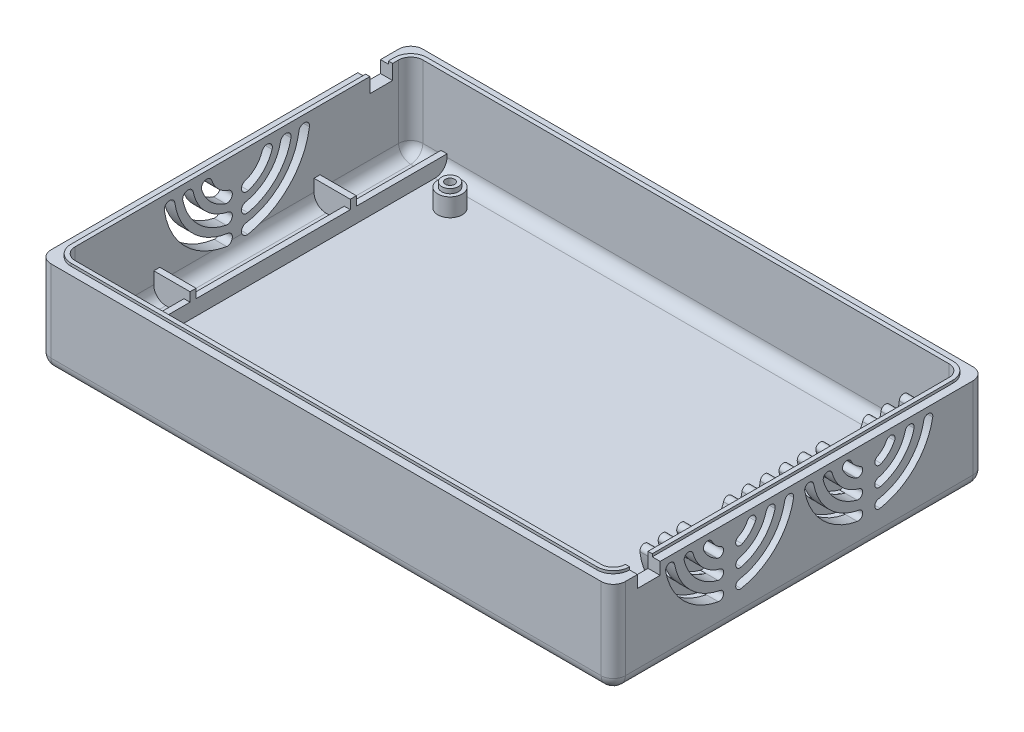
from build123d import *
from build123d.topology import SkipClean

# Parameters (mm, degrees)
SKETCH1_W            = 190
SKETCH1_H            = 123
SKETCH1_R            = 1.5
BOSS_EXTRUDE1_DEPTH  = 4
SKETCH3_R            = 4
SKETCH3_R_2          = 1.5
BOSS_EXTRUDE3_DEPTH  = 6
SKETCH4_R            = 2.75
SKETCH4_R_2          = 1.5
BOSS_EXTRUDE4_DEPTH  = 1.5
SKETCH2_W            = 190
SKETCH2_H            = 123
SKETCH2_W_2          = 182
SKETCH2_H_2          = 115
BOSS_EXTRUDE2_DEPTH  = 27
FILLET1_R            = 4
FILLET2_R            = 4
SKETCH6_R            = 6
SKETCH6_R_2          = 3
BOSS_EXTRUDE5_DEPTH  = 4
FILLET3_R            = 2
SKETCH7_W            = 2
SKETCH7_H            = 115
BOSS_EXTRUDE6_DEPTH  = 5
SKETCH8_W            = 4
SKETCH8_H            = 7.5
CUT_EXTRUDE1_DEPTH   = 4
CUT_EXTRUDE2_DEPTH   = 10
CUT_EXTRUDE4_DEPTH   = 10
BOSS_EXTRUDE8_DEPTH  = 1.8
BOSS_EXTRUDE9_DEPTH  = 2.5
SKETCH13_W           = 12
SKETCH13_H           = 2
BOSS_EXTRUDE10_DEPTH = 8
BOSS_EXTRUDE11_START = 0.9
BOSS_EXTRUDE11_DEPTH = 0.9


with BuildPart() as part:
    # Sketch1 → Boss-Extrude1 (new body)
    with BuildSketch(Plane(origin=(0, 0, 0), x_dir=(1, 0, 0), z_dir=(0, 1, 0))):
        with Locations((-5.5, 0)):
            Rectangle(SKETCH1_W, SKETCH1_H)
        with Locations(Location((73.5, -47.5, 0), (0, 0, 270))):
            Circle(SKETCH1_R, mode=Mode.SUBTRACT)
        with Locations(Location((73.5, 47.5, 0), (0, 0, 270))):
            Circle(SKETCH1_R, mode=Mode.SUBTRACT)
        with Locations(Location((-73.5, 47.5, 0), (0, 0, 270))):
            Circle(SKETCH1_R, mode=Mode.SUBTRACT)
        with Locations(Location((-73.5, -47.5, 0), (0, 0, 270))):
            Circle(SKETCH1_R, mode=Mode.SUBTRACT)
    extrude(amount=BOSS_EXTRUDE1_DEPTH)

    # Sketch3 → Boss-Extrude3 (add)
    # profile 1 of 4: a face of its own
    with BuildSketch(Plane(origin=(0, 4, 0), x_dir=(1, 0, 0), z_dir=(0, 1, 0))):
        with Locations(Location((-73.5, 47.5, 0), (0, 0, 270))):
            Circle(SKETCH3_R)
        with Locations(Location((-73.5, 47.5, 0), (0, 0, 270))):
            Circle(SKETCH3_R_2, mode=Mode.SUBTRACT)
    # profile 2 of 4: a face of its own
    with BuildSketch(Plane(origin=(0, 4, 0), x_dir=(1, 0, 0), z_dir=(0, 1, 0))):
        with Locations(Location((-73.5, -47.5, 0), (0, 0, 270))):
            Circle(SKETCH3_R)
        with Locations(Location((-73.5, -47.5, 0), (0, 0, 270))):
            Circle(SKETCH3_R_2, mode=Mode.SUBTRACT)
    # profile 3 of 4: a face of its own
    with BuildSketch(Plane(origin=(0, 4, 0), x_dir=(1, 0, 0), z_dir=(0, 1, 0))):
        with Locations(Location((73.5, -47.5, 0), (0, 0, 270))):
            Circle(SKETCH3_R)
        with Locations(Location((73.5, -47.5, 0), (0, 0, 270))):
            Circle(SKETCH3_R_2, mode=Mode.SUBTRACT)
    # profile 4 of 4: a face of its own
    with BuildSketch(Plane(origin=(0, 4, 0), x_dir=(1, 0, 0), z_dir=(0, 1, 0))):
        with Locations(Location((73.5, 47.5, 0), (0, 0, 270))):
            Circle(SKETCH3_R)
        with Locations(Location((73.5, 47.5, 0), (0, 0, 270))):
            Circle(SKETCH3_R_2, mode=Mode.SUBTRACT)
    extrude(amount=BOSS_EXTRUDE3_DEPTH)

    # Sketch4 → Boss-Extrude4 (add)
    # profile 1 of 4: a face of its own
    with BuildSketch(Plane(origin=(0, 10, 0), x_dir=(1, 0, 0), z_dir=(0, 1, 0))):
        with Locations(Location((-73.5, 47.5, 0), (0, 0, 270))):
            Circle(SKETCH4_R)
        with Locations(Location((-73.5, 47.5, 0), (0, 0, 270))):
            Circle(SKETCH4_R_2, mode=Mode.SUBTRACT)
    # profile 2 of 4: a face of its own
    with BuildSketch(Plane(origin=(0, 10, 0), x_dir=(1, 0, 0), z_dir=(0, 1, 0))):
        with Locations(Location((73.5, 47.5, 0), (0, 0, 270))):
            Circle(SKETCH4_R)
        with Locations(Location((73.5, 47.5, 0), (0, 0, 270))):
            Circle(SKETCH4_R_2, mode=Mode.SUBTRACT)
    # profile 3 of 4: a face of its own
    with BuildSketch(Plane(origin=(0, 10, 0), x_dir=(1, 0, 0), z_dir=(0, 1, 0))):
        with Locations(Location((73.5, -47.5, 0), (0, 0, 270))):
            Circle(SKETCH4_R)
        with Locations(Location((73.5, -47.5, 0), (0, 0, 270))):
            Circle(SKETCH4_R_2, mode=Mode.SUBTRACT)
    # profile 4 of 4: a face of its own
    with BuildSketch(Plane(origin=(0, 10, 0), x_dir=(1, 0, 0), z_dir=(0, 1, 0))):
        with Locations(Location((-73.5, -47.5, 0), (0, 0, 270))):
            Circle(SKETCH4_R)
        with Locations(Location((-73.5, -47.5, 0), (0, 0, 270))):
            Circle(SKETCH4_R_2, mode=Mode.SUBTRACT)
    extrude(amount=BOSS_EXTRUDE4_DEPTH)

    # Sketch2 → Boss-Extrude2 (add)
    with BuildSketch(Plane(origin=(0, 4, 0), x_dir=(1, 0, 0), z_dir=(0, 1, 0))):
        with Locations((-5.5, 0)):
            Rectangle(SKETCH2_W, SKETCH2_H)
        with Locations((-5.5, 0)):
            Rectangle(SKETCH2_W_2, SKETCH2_H_2, mode=Mode.SUBTRACT)
    extrude(amount=BOSS_EXTRUDE2_DEPTH)

    # Fillet1
    fillet1_edges = [part.edges().sort_by_distance(p)[0] for p in [
        (-5.5, 4, -57.5),
        (-96.5, 4, 0),
        (-5.5, 4, 57.5),
        (85.5, 4, 0),
        (-96.5, 17.5, -57.5),
        (-96.5, 17.5, 57.5),
        (85.5, 17.5, 57.5),
        (85.5, 17.5, -57.5),
    ]]
    fillet(fillet1_edges, radius=FILLET1_R)

    # Fillet2
    fillet2_edges = [part.edges().sort_by_distance(p)[0] for p in [
        (-5.5, 0, -61.5),
        (89.5, 0, 0),
        (-5.5, 0, 61.5),
        (-100.5, 0, 0),
        (-100.5, 15.5, -61.5),
        (89.5, 15.5, -61.5),
        (89.5, 15.5, 61.5),
        (-100.5, 15.5, 61.5),
    ]]
    fillet(fillet2_edges, radius=FILLET2_R)

    # Sketch6 → Boss-Extrude5 (add)
    # profile 1 of 4: a face of its own
    with BuildSketch(Plane.XZ):
        with Locations(Location((-73.5, 47.5, 0), (0, 0, 90))):
            Circle(SKETCH6_R)
        with Locations(Location((-73.5, 47.5, 0), (0, 0, 270))):
            Circle(SKETCH6_R_2, mode=Mode.SUBTRACT)
    # profile 2 of 4: a face of its own
    with BuildSketch(Plane.XZ):
        with Locations(Location((-73.5, -47.5, 0), (0, 0, 90))):
            Circle(SKETCH6_R)
        with Locations(Location((-73.5, -47.5, 0), (0, 0, 270))):
            Circle(SKETCH6_R_2, mode=Mode.SUBTRACT)
    # profile 3 of 4: a face of its own
    with BuildSketch(Plane.XZ):
        with Locations(Location((73.5, -47.5, 0), (0, 0, 90))):
            Circle(SKETCH6_R)
        with Locations(Location((73.5, -47.5, 0), (0, 0, 270))):
            Circle(SKETCH6_R_2, mode=Mode.SUBTRACT)
    # profile 4 of 4: a face of its own
    with BuildSketch(Plane.XZ):
        with Locations(Location((73.5, 47.5, 0), (0, 0, 90))):
            Circle(SKETCH6_R)
        with Locations(Location((73.5, 47.5, 0), (0, 0, 270))):
            Circle(SKETCH6_R_2, mode=Mode.SUBTRACT)
    extrude(amount=BOSS_EXTRUDE5_DEPTH)

    # Fillet3
    fillet3_edges = [part.edges().sort_by_distance(p)[0] for p in [
        (-73.5, 0, 41.5),
        (-73.5, -4, 41.5),
        (-73.5, 0, -53.5),
        (-73.5, -4, -53.5),
        (73.5, 0, -53.5),
        (73.5, -4, -53.5),
        (73.5, 0, 41.5),
        (73.5, -4, 41.5),
    ]]
    fillet(fillet3_edges, radius=FILLET3_R - 0.0001)  # a hair under: the kernel refuses the full size

    # Sketch7 → Boss-Extrude6 (add)
    with BuildSketch(Plane(origin=(0, 4, 0), x_dir=(1, 0, 0), z_dir=(0, 1, 0))):
        with Locations((-85.5, 0)):
            Rectangle(SKETCH7_W, SKETCH7_H)
    extrude(amount=BOSS_EXTRUDE6_DEPTH)

    # Sketch8 → Cut-Extrude1 (cut)
    with BuildSketch(Plane(origin=(0, 31, 0), x_dir=(1, 0, 0), z_dir=(0, 1, 0))):
        with Locations((-98.5, 47.75)):
            Rectangle(SKETCH8_W, SKETCH8_H)
        with Locations((87.5, -49.75)):
            Rectangle(SKETCH8_W, SKETCH8_H)
    extrude(amount=-CUT_EXTRUDE1_DEPTH, mode=Mode.SUBTRACT)

    # Sketch9 → Cut-Extrude2 (cut)
    with BuildSketch(Plane.ZY.offset(100.5)):
        with BuildLine():
            ThreePointArc((-11.648423236, 27.208333333), (-8.66205807, 22.33794193), (-3.791666667, 19.351576764))
            ThreePointArc((-3.791666667, 19.351576764), (-1.585939538, 20.473970559), (-2.708333333, 22.679697688))
            ThreePointArc((-2.708333333, 22.679697688), (-6.187184335, 24.812815665), (-8.320302312, 28.291666667))
            ThreePointArc((-8.320302312, 28.291666667), (-10.526029441, 29.414060462), (-11.648423236, 27.208333333))
        make_face()
        with BuildLine():
            ThreePointArc((-17.892474778, 27.40530303), (-12.904698757, 18.095301243), (-3.59469697, 13.107525222))
            ThreePointArc((-3.59469697, 13.107525222), (-1.53428324, 14.478545011), (-2.90530303, 16.538958741))
            ThreePointArc((-2.90530303, 16.538958741), (-10.429825023, 20.570174977), (-14.461041259, 28.09469697))
            ThreePointArc((-14.461041259, 28.09469697), (-16.521454989, 29.46571676), (-17.892474778, 27.40530303))
        make_face()
        with BuildLine():
            ThreePointArc((-23.995688109, 27.497222222), (-17.147339444, 13.852660556), (-3.502777778, 7.004311891))
            ThreePointArc((-3.502777778, 7.004311891), (-1.518352404, 8.483181708), (-2.997222222, 10.467607082))
            ThreePointArc((-2.997222222, 10.467607082), (-14.67246571, 16.32753429), (-20.532392918, 28.002777778))
            ThreePointArc((-20.532392918, 28.002777778), (-22.516818292, 29.481647596), (-23.995688109, 27.497222222))
        make_face()
        with BuildLine():
            ThreePointArc((3.502777778, 7.004311891), (17.147339444, 13.852660556), (23.995688109, 27.497222222))
            ThreePointArc((23.995688109, 27.497222222), (22.516818292, 29.481647596), (20.532392918, 28.002777778))
            ThreePointArc((20.532392918, 28.002777778), (14.67246571, 16.32753429), (2.997222222, 10.467607082))
            ThreePointArc((2.997222222, 10.467607082), (1.518352404, 8.483181708), (3.502777778, 7.004311891))
        make_face()
        with BuildLine():
            ThreePointArc((3.791666667, 19.351576764), (8.66205807, 22.33794193), (11.648423236, 27.208333333))
            ThreePointArc((11.648423236, 27.208333333), (10.526029441, 29.414060462), (8.320302312, 28.291666667))
            ThreePointArc((8.320302312, 28.291666667), (6.187184335, 24.812815665), (2.708333333, 22.679697688))
            ThreePointArc((2.708333333, 22.679697688), (1.585939538, 20.473970559), (3.791666667, 19.351576764))
        make_face()
        with BuildLine():
            ThreePointArc((3.59469697, 13.107525222), (12.904698757, 18.095301243), (17.892474778, 27.40530303))
            ThreePointArc((17.892474778, 27.40530303), (16.521454989, 29.46571676), (14.461041259, 28.09469697))
            ThreePointArc((14.461041259, 28.09469697), (10.429825023, 20.570174977), (2.90530303, 16.538958741))
            ThreePointArc((2.90530303, 16.538958741), (1.53428324, 14.478545011), (3.59469697, 13.107525222))
        make_face()
    extrude(amount=-CUT_EXTRUDE2_DEPTH, mode=Mode.SUBTRACT)

    # Sketch10 → Cut-Extrude4 (cut)
    with BuildSketch(Plane(origin=(89.5, 0, 0), x_dir=(0, 0, -1), z_dir=(1, 0, 0))):
        with BuildLine():
            ThreePointArc((1.831778682, 27.2375), (7.797204204, 15.797204204), (19.2375, 9.831778682))
            ThreePointArc((19.2375, 9.831778682), (20.97685265, 11.046131332), (19.7625, 12.785483983))
            ThreePointArc((19.7625, 12.785483983), (9.918524548, 17.918524548), (4.785483983, 27.7625))
            ThreePointArc((4.785483983, 27.7625), (3.046131332, 28.97685265), (1.831778682, 27.2375))
        make_face()
        with BuildLine():
            ThreePointArc((7.992189533, 27.125), (12.039844892, 20.039844892), (19.125, 15.992189533))
            ThreePointArc((19.125, 15.992189533), (20.952368755, 17.069558288), (19.875, 18.896927043))
            ThreePointArc((19.875, 18.896927043), (14.161165235, 22.161165235), (10.896927043, 27.875))
            ThreePointArc((10.896927043, 27.875), (9.069558288, 28.952368755), (7.992189533, 27.125))
        make_face()
        with BuildLine():
            ThreePointArc((14.457425099, 26.84375), (16.282485579, 24.282485579), (18.84375, 22.457425099))
            ThreePointArc((18.84375, 22.457425099), (20.848827616, 23.150002715), (20.15625, 25.155080331))
            ThreePointArc((20.15625, 25.155080331), (18.403805922, 26.403805922), (17.155080331, 28.15625))
            ThreePointArc((17.155080331, 28.15625), (15.150002715, 28.848827616), (14.457425099, 26.84375))
        make_face()
        with BuildLine():
            ThreePointArc((44.168221318, 27.2375), (38.202795796, 15.797204204), (26.7625, 9.831778682))
            ThreePointArc((26.7625, 9.831778682), (25.02314735, 11.046131332), (26.2375, 12.785483983))
            ThreePointArc((26.2375, 12.785483983), (36.081475452, 17.918524548), (41.214516017, 27.7625))
            ThreePointArc((41.214516017, 27.7625), (42.953868668, 28.97685265), (44.168221318, 27.2375))
        make_face()
        with BuildLine():
            ThreePointArc((38.007810467, 27.125), (33.960155108, 20.039844892), (26.875, 15.992189533))
            ThreePointArc((26.875, 15.992189533), (25.047631245, 17.069558288), (26.125, 18.896927043))
            ThreePointArc((26.125, 18.896927043), (31.838834765, 22.161165235), (35.103072957, 27.875))
            ThreePointArc((35.103072957, 27.875), (36.930441712, 28.952368755), (38.007810467, 27.125))
        make_face()
        with BuildLine():
            ThreePointArc((31.542574901, 26.84375), (29.717514421, 24.282485579), (27.15625, 22.457425099))
            ThreePointArc((27.15625, 22.457425099), (25.151172384, 23.150002715), (25.84375, 25.155080331))
            ThreePointArc((25.84375, 25.155080331), (27.596194078, 26.403805922), (28.844919669, 28.15625))
            ThreePointArc((28.844919669, 28.15625), (30.849997285, 28.848827616), (31.542574901, 26.84375))
        make_face()
        with BuildLine():
            ThreePointArc((1.831778682, 34.7625), (7.797204204, 46.202795796), (19.2375, 52.168221318))
            ThreePointArc((19.2375, 52.168221318), (20.97685265, 50.953868668), (19.7625, 49.214516017))
            ThreePointArc((19.7625, 49.214516017), (9.918524548, 44.081475452), (4.785483983, 34.2375))
            ThreePointArc((4.785483983, 34.2375), (3.046131332, 33.02314735), (1.831778682, 34.7625))
        make_face()
        with BuildLine():
            ThreePointArc((7.992189533, 34.875), (12.039844892, 41.960155108), (19.125, 46.007810467))
            ThreePointArc((19.125, 46.007810467), (20.952368755, 44.930441712), (19.875, 43.103072957))
            ThreePointArc((19.875, 43.103072957), (14.161165235, 39.838834765), (10.896927043, 34.125))
            ThreePointArc((10.896927043, 34.125), (9.069558288, 33.047631245), (7.992189533, 34.875))
        make_face()
        with BuildLine():
            ThreePointArc((14.457425099, 35.15625), (16.282485579, 37.717514421), (18.84375, 39.542574901))
            ThreePointArc((18.84375, 39.542574901), (20.848827616, 38.849997285), (20.15625, 36.844919669))
            ThreePointArc((20.15625, 36.844919669), (18.403805922, 35.596194078), (17.155080331, 33.84375))
            ThreePointArc((17.155080331, 33.84375), (15.150002715, 33.151172384), (14.457425099, 35.15625))
        make_face()
        with BuildLine():
            ThreePointArc((44.168221318, 34.7625), (38.202795796, 46.202795796), (26.7625, 52.168221318))
            ThreePointArc((26.7625, 52.168221318), (25.02314735, 50.953868668), (26.2375, 49.214516017))
            ThreePointArc((26.2375, 49.214516017), (36.081475452, 44.081475452), (41.214516017, 34.2375))
            ThreePointArc((41.214516017, 34.2375), (42.953868668, 33.02314735), (44.168221318, 34.7625))
        make_face()
        with BuildLine():
            ThreePointArc((38.007810467, 34.875), (33.960155108, 41.960155108), (26.875, 46.007810467))
            ThreePointArc((26.875, 46.007810467), (25.047631245, 44.930441712), (26.125, 43.103072957))
            ThreePointArc((26.125, 43.103072957), (31.838834765, 39.838834765), (35.103072957, 34.125))
            ThreePointArc((35.103072957, 34.125), (36.930441712, 33.047631245), (38.007810467, 34.875))
        make_face()
        with BuildLine():
            ThreePointArc((31.542574901, 35.15625), (29.717514421, 37.717514421), (27.15625, 39.542574901))
            ThreePointArc((27.15625, 39.542574901), (25.151172384, 38.849997285), (25.84375, 36.844919669))
            ThreePointArc((25.84375, 36.844919669), (27.596194078, 35.596194078), (28.844919669, 33.84375))
            ThreePointArc((28.844919669, 33.84375), (30.849997285, 33.151172384), (31.542574901, 35.15625))
        make_face()
    cut_extrude4 = extrude(amount=-CUT_EXTRUDE4_DEPTH, mode=Mode.SUBTRACT)

    # Sketch11 → Boss-Extrude8 (add)
    with BuildSketch(Plane.ZY.offset(-85.5)):
        with BuildLine():
            ThreePointArc((-44.390674712, 28.834581944), (-44.294425926, 28.033954738), (-44.168221318, 27.2375))
            ThreePointArc((-44.168221318, 27.2375), (-42.953868668, 28.97685265), (-41.214516017, 27.7625))
            ThreePointArc((-41.214516017, 27.7625), (-41.32311068, 28.447821519), (-41.405929404, 29.136733301))
            ThreePointArc((-41.405929404, 29.136733301), (-43.049377736, 30.478030277), (-44.390674712, 28.834581944))
        make_face()
        with BuildLine():
            ThreePointArc((-38.336251081, 28.752912375), (-38.193848837, 27.934554269), (-38.007810467, 27.125))
            ThreePointArc((-38.007810467, 27.125), (-36.930441712, 28.952368755), (-35.103072957, 27.875))
            ThreePointArc((-35.103072957, 27.875), (-35.2531039, 28.527866346), (-35.36794442, 29.187832561))
            ThreePointArc((-35.36794442, 29.187832561), (-37.069557843, 30.454525798), (-38.336251081, 28.752912375))
        make_face()
        with BuildLine():
            ThreePointArc((-32.168277124, 28.511487477), (-31.894599875, 27.662921477), (-31.542574901, 26.84375))
            ThreePointArc((-31.542574901, 26.84375), (-30.849997285, 28.848827616), (-28.844919669, 28.15625))
            ThreePointArc((-28.844919669, 28.15625), (-29.085778862, 28.716735748), (-29.273031716, 29.297333537))
            ThreePointArc((-29.273031716, 29.297333537), (-31.11357745, 30.35203321), (-32.168277124, 28.511487477))
        make_face()
        with BuildLine():
            ThreePointArc((-25.84375, 25.155080331), (-25.151172384, 23.150002715), (-27.15625, 22.457425099))
            ThreePointArc((-27.15625, 22.457425099), (-26.337078523, 22.105400125), (-25.488512523, 21.831722876))
            ThreePointArc((-25.488512523, 21.831722876), (-23.64796679, 22.88642255), (-24.702666463, 24.726968284))
            ThreePointArc((-24.702666463, 24.726968284), (-25.283264252, 24.914221138), (-25.84375, 25.155080331))
        make_face()
        with BuildLine():
            ThreePointArc((-26.125, 18.896927043), (-25.047631245, 17.069558288), (-26.875, 15.992189533))
            ThreePointArc((-26.875, 15.992189533), (-26.065445731, 15.806151163), (-25.247087625, 15.663748919))
            ThreePointArc((-25.247087625, 15.663748919), (-23.545474202, 16.930442157), (-24.812167439, 18.63205558))
            ThreePointArc((-24.812167439, 18.63205558), (-25.472133654, 18.7468961), (-26.125, 18.896927043))
        make_face()
        with BuildLine():
            ThreePointArc((-26.2375, 12.785483983), (-25.02314735, 11.046131332), (-26.7625, 9.831778682))
            ThreePointArc((-26.7625, 9.831778682), (-25.966045262, 9.705574074), (-25.165418056, 9.609325288))
            ThreePointArc((-25.165418056, 9.609325288), (-23.521969723, 10.950622264), (-24.863266699, 12.594070596))
            ThreePointArc((-24.863266699, 12.594070596), (-25.552178481, 12.67688932), (-26.2375, 12.785483983))
        make_face()
        with BuildLine():
            ThreePointArc((-20.834581944, 9.609325288), (-20.033954738, 9.705574074), (-19.2375, 9.831778682))
            ThreePointArc((-19.2375, 9.831778682), (-20.97685265, 11.046131332), (-19.7625, 12.785483983))
            ThreePointArc((-19.7625, 12.785483983), (-20.447821519, 12.67688932), (-21.136733301, 12.594070596))
            ThreePointArc((-21.136733301, 12.594070596), (-22.478030277, 10.950622264), (-20.834581944, 9.609325288))
        make_face()
        with BuildLine():
            ThreePointArc((-20.752912375, 15.663748919), (-19.934554269, 15.806151163), (-19.125, 15.992189533))
            ThreePointArc((-19.125, 15.992189533), (-20.952368755, 17.069558288), (-19.875, 18.896927043))
            ThreePointArc((-19.875, 18.896927043), (-20.527866346, 18.7468961), (-21.187832561, 18.63205558))
            ThreePointArc((-21.187832561, 18.63205558), (-22.454525798, 16.930442157), (-20.752912375, 15.663748919))
        make_face()
        with BuildLine():
            ThreePointArc((-18.84375, 22.457425099), (-20.848827616, 23.150002715), (-20.15625, 25.155080331))
            ThreePointArc((-20.15625, 25.155080331), (-20.716735748, 24.914221138), (-21.297333537, 24.726968284))
            ThreePointArc((-21.297333537, 24.726968284), (-22.35203321, 22.88642255), (-20.511487477, 21.831722876))
            ThreePointArc((-20.511487477, 21.831722876), (-19.662921477, 22.105400125), (-18.84375, 22.457425099))
        make_face()
        with BuildLine():
            ThreePointArc((-16.726968284, 29.297333537), (-16.914221138, 28.716735748), (-17.155080331, 28.15625))
            ThreePointArc((-17.155080331, 28.15625), (-15.150002715, 28.848827616), (-14.457425099, 26.84375))
            ThreePointArc((-14.457425099, 26.84375), (-14.105400125, 27.662921477), (-13.831722876, 28.511487477))
            ThreePointArc((-13.831722876, 28.511487477), (-14.88642255, 30.35203321), (-16.726968284, 29.297333537))
        make_face()
        with BuildLine():
            ThreePointArc((-10.896927043, 27.875), (-9.069558288, 28.952368755), (-7.992189533, 27.125))
            ThreePointArc((-7.992189533, 27.125), (-7.806151163, 27.934554269), (-7.663748919, 28.752912375))
            ThreePointArc((-7.663748919, 28.752912375), (-8.930442157, 30.454525798), (-10.63205558, 29.187832561))
            ThreePointArc((-10.63205558, 29.187832561), (-10.7468961, 28.527866346), (-10.896927043, 27.875))
        make_face()
        with BuildLine():
            ThreePointArc((-4.785483983, 27.7625), (-3.046131332, 28.97685265), (-1.831778682, 27.2375))
            ThreePointArc((-1.831778682, 27.2375), (-1.705574074, 28.033954738), (-1.609325288, 28.834581944))
            ThreePointArc((-1.609325288, 28.834581944), (-2.950622264, 30.478030277), (-4.594070596, 29.136733301))
            ThreePointArc((-4.594070596, 29.136733301), (-4.67688932, 28.447821519), (-4.785483983, 27.7625))
        make_face()
    boss_extrude8 = extrude(amount=BOSS_EXTRUDE8_DEPTH)

    # Sketch12 → Boss-Extrude9 (add)
    with SkipClean():  # the faces are left unmerged after this step: merging them gives an invalid solid
        with BuildSketch(Plane.ZY.offset(-83.7)):
            with BuildLine():
                ThreePointArc((-26.2375, 12.785483983), (-36.081475452, 17.918524548), (-41.214516017, 27.7625))
                ThreePointArc((-41.214516017, 27.7625), (-42.953868668, 28.97685265), (-44.168221318, 27.2375))
                ThreePointArc((-44.168221318, 27.2375), (-38.202795796, 15.797204204), (-26.7625, 9.831778682))
                ThreePointArc((-26.7625, 9.831778682), (-25.966045262, 9.705574074), (-25.165418056, 9.609325288))
                ThreePointArc((-25.165418056, 9.609325288), (-23.521969723, 10.950622264), (-24.863266699, 12.594070596))
                ThreePointArc((-24.863266699, 12.594070596), (-25.552178481, 12.67688932), (-26.2375, 12.785483983))
            make_face()
            with BuildLine():
                ThreePointArc((-26.125, 18.896927043), (-31.838834765, 22.161165235), (-35.103072957, 27.875))
                ThreePointArc((-35.103072957, 27.875), (-35.2531039, 28.527866346), (-35.36794442, 29.187832561))
                ThreePointArc((-35.36794442, 29.187832561), (-37.069557843, 30.454525798), (-38.336251081, 28.752912375))
                ThreePointArc((-38.336251081, 28.752912375), (-38.193848837, 27.934554269), (-38.007810467, 27.125))
                ThreePointArc((-38.007810467, 27.125), (-33.960155108, 20.039844892), (-26.875, 15.992189533))
                ThreePointArc((-26.875, 15.992189533), (-26.065445731, 15.806151163), (-25.247087625, 15.663748919))
                ThreePointArc((-25.247087625, 15.663748919), (-23.545474202, 16.930442157), (-24.812167439, 18.63205558))
                ThreePointArc((-24.812167439, 18.63205558), (-25.472133654, 18.7468961), (-26.125, 18.896927043))
            make_face()
            with BuildLine():
                ThreePointArc((-25.84375, 25.155080331), (-27.596194078, 26.403805922), (-28.844919669, 28.15625))
                ThreePointArc((-28.844919669, 28.15625), (-29.085778862, 28.716735748), (-29.273031716, 29.297333537))
                ThreePointArc((-29.273031716, 29.297333537), (-31.11357745, 30.35203321), (-32.168277124, 28.511487477))
                ThreePointArc((-32.168277124, 28.511487477), (-31.894599875, 27.662921477), (-31.542574901, 26.84375))
                ThreePointArc((-31.542574901, 26.84375), (-29.717514421, 24.282485579), (-27.15625, 22.457425099))
                ThreePointArc((-27.15625, 22.457425099), (-26.337078523, 22.105400125), (-25.488512523, 21.831722876))
                ThreePointArc((-25.488512523, 21.831722876), (-23.64796679, 22.88642255), (-24.702666463, 24.726968284))
                ThreePointArc((-24.702666463, 24.726968284), (-25.283264252, 24.914221138), (-25.84375, 25.155080331))
            make_face()
            with BuildLine():
                ThreePointArc((-20.15625, 25.155080331), (-18.403805922, 26.403805922), (-17.155080331, 28.15625))
                ThreePointArc((-17.155080331, 28.15625), (-15.150002715, 28.848827616), (-14.457425099, 26.84375))
                ThreePointArc((-14.457425099, 26.84375), (-16.282485579, 24.282485579), (-18.84375, 22.457425099))
                ThreePointArc((-18.84375, 22.457425099), (-20.848827616, 23.150002715), (-20.15625, 25.155080331))
            make_face()
            with BuildLine():
                ThreePointArc((-19.875, 18.896927043), (-20.952368755, 17.069558288), (-19.125, 15.992189533))
                ThreePointArc((-19.125, 15.992189533), (-12.039844892, 20.039844892), (-7.992189533, 27.125))
                ThreePointArc((-7.992189533, 27.125), (-9.069558288, 28.952368755), (-10.896927043, 27.875))
                ThreePointArc((-10.896927043, 27.875), (-14.161165235, 22.161165235), (-19.875, 18.896927043))
            make_face()
            with BuildLine():
                ThreePointArc((-19.7625, 12.785483983), (-20.97685265, 11.046131332), (-19.2375, 9.831778682))
                ThreePointArc((-19.2375, 9.831778682), (-7.797204204, 15.797204204), (-1.831778682, 27.2375))
                ThreePointArc((-1.831778682, 27.2375), (-3.046131332, 28.97685265), (-4.785483983, 27.7625))
                ThreePointArc((-4.785483983, 27.7625), (-9.918524548, 17.918524548), (-19.7625, 12.785483983))
            make_face()
            with BuildLine():
                ThreePointArc((-4.594070596, 29.136733301), (-4.67688932, 28.447821519), (-4.785483983, 27.7625))
                ThreePointArc((-4.785483983, 27.7625), (-3.046131332, 28.97685265), (-1.831778682, 27.2375))
                ThreePointArc((-1.831778682, 27.2375), (-1.705574074, 28.033954738), (-1.609325288, 28.834581944))
                ThreePointArc((-1.609325288, 28.834581944), (-2.950622264, 30.478030277), (-4.594070596, 29.136733301))
            make_face()
            with BuildLine():
                ThreePointArc((-10.63205558, 29.187832561), (-10.7468961, 28.527866346), (-10.896927043, 27.875))
                ThreePointArc((-10.896927043, 27.875), (-9.069558288, 28.952368755), (-7.992189533, 27.125))
                ThreePointArc((-7.992189533, 27.125), (-7.806151163, 27.934554269), (-7.663748919, 28.752912375))
                ThreePointArc((-7.663748919, 28.752912375), (-8.930442157, 30.454525798), (-10.63205558, 29.187832561))
            make_face()
            with BuildLine():
                ThreePointArc((-16.726968284, 29.297333537), (-16.914221138, 28.716735748), (-17.155080331, 28.15625))
                ThreePointArc((-17.155080331, 28.15625), (-15.150002715, 28.848827616), (-14.457425099, 26.84375))
                ThreePointArc((-14.457425099, 26.84375), (-14.105400125, 27.662921477), (-13.831722876, 28.511487477))
                ThreePointArc((-13.831722876, 28.511487477), (-14.88642255, 30.35203321), (-16.726968284, 29.297333537))
            make_face()
            with BuildLine():
                ThreePointArc((-18.84375, 22.457425099), (-20.848827616, 23.150002715), (-20.15625, 25.155080331))
                ThreePointArc((-20.15625, 25.155080331), (-20.716735748, 24.914221138), (-21.297333537, 24.726968284))
                ThreePointArc((-21.297333537, 24.726968284), (-22.35203321, 22.88642255), (-20.511487477, 21.831722876))
                ThreePointArc((-20.511487477, 21.831722876), (-19.662921477, 22.105400125), (-18.84375, 22.457425099))
            make_face()
            with BuildLine():
                ThreePointArc((-19.125, 15.992189533), (-20.952368755, 17.069558288), (-19.875, 18.896927043))
                ThreePointArc((-19.875, 18.896927043), (-20.527866346, 18.7468961), (-21.187832561, 18.63205558))
                ThreePointArc((-21.187832561, 18.63205558), (-22.454525798, 16.930442157), (-20.752912375, 15.663748919))
                ThreePointArc((-20.752912375, 15.663748919), (-19.934554269, 15.806151163), (-19.125, 15.992189533))
            make_face()
            with BuildLine():
                ThreePointArc((-19.2375, 9.831778682), (-20.97685265, 11.046131332), (-19.7625, 12.785483983))
                ThreePointArc((-19.7625, 12.785483983), (-20.447821519, 12.67688932), (-21.136733301, 12.594070596))
                ThreePointArc((-21.136733301, 12.594070596), (-22.478030277, 10.950622264), (-20.834581944, 9.609325288))
                ThreePointArc((-20.834581944, 9.609325288), (-20.033954738, 9.705574074), (-19.2375, 9.831778682))
            make_face()
            with BuildLine():
                ThreePointArc((-44.168221318, 27.2375), (-42.953868668, 28.97685265), (-41.214516017, 27.7625))
                ThreePointArc((-41.214516017, 27.7625), (-41.32311068, 28.447821519), (-41.405929404, 29.136733301))
                ThreePointArc((-41.405929404, 29.136733301), (-43.049377736, 30.478030277), (-44.390674712, 28.834581944))
                ThreePointArc((-44.390674712, 28.834581944), (-44.294425926, 28.033954738), (-44.168221318, 27.2375))
            make_face()
        boss_extrude9 = extrude(amount=BOSS_EXTRUDE9_DEPTH)

    # Mirror1: Cut-Extrude4, Boss-Extrude8, Boss-Extrude9 across plane
    with SkipClean():  # the faces are left unmerged after this step: merging them gives an invalid solid
        add(cut_extrude4.mirror(Plane.XY), mode=Mode.SUBTRACT)
        add(boss_extrude8.mirror(Plane.XY))
        add(boss_extrude9.mirror(Plane.XY))

    # Sketch13 → Boss-Extrude10 (add)
    with SkipClean():  # the faces are left unmerged after this step: merging them gives an invalid solid
        with BuildSketch(Plane(origin=(0, 4, 0), x_dir=(1, 0, 0), z_dir=(0, 1, 0))):
            with Locations((-90.5, 26.5)):
                Rectangle(SKETCH13_W, SKETCH13_H)
            with Locations((-90.5, -26.5)):
                Rectangle(SKETCH13_W, SKETCH13_H)
        extrude(amount=BOSS_EXTRUDE10_DEPTH)

    # Sketch14 → Boss-Extrude11 (add)
    with SkipClean():  # the faces are left unmerged after this step: merging them gives an invalid solid
        with BuildSketch(Plane(origin=(0, 31, 0), x_dir=(1, 0, 0), z_dir=(0, 1, 0)).offset(BOSS_EXTRUDE11_START)):
            with BuildLine():
                Line((-97.9, 53.5), (-97.9, 51.5))
                Line((-97.9, 51.5), (-96.5, 51.5))
                Line((-96.5, 51.5), (-96.5, 53.5))
                ThreePointArc((-96.5, 53.5), (-95.328427125, 56.328427125), (-92.5, 57.5))
                Line((-92.5, 57.5), (81.5, 57.5))
                ThreePointArc((81.5, 57.5), (84.328427125, 56.328427125), (85.5, 53.5))
                Line((85.5, 53.5), (85.5, -46))
                Line((85.5, -46), (86.9, -46))
                Line((86.9, -46), (86.9, 53.5))
                ThreePointArc((86.9, 53.5), (85.318376618, 57.318376618), (81.5, 58.9))
                Line((81.5, 58.9), (-92.5, 58.9))
                ThreePointArc((-92.5, 58.9), (-96.318376618, 57.318376618), (-97.9, 53.5))
            make_face()
            with BuildLine():
                Line((-96.5, -53.5), (-96.5, 44))
                Line((-96.5, 44), (-97.9, 44))
                Line((-97.9, 44), (-97.9, -53.5))
                ThreePointArc((-97.9, -53.5), (-96.318376618, -57.318376618), (-92.5, -58.9))
                Line((-92.5, -58.9), (81.5, -58.9))
                ThreePointArc((81.5, -58.9), (85.318376618, -57.318376618), (86.9, -53.5))
                Line((86.9, -53.5), (85.5, -53.5))
                ThreePointArc((85.5, -53.5), (84.328427125, -56.328427125), (81.5, -57.5))
                Line((81.5, -57.5), (-92.5, -57.5))
                ThreePointArc((-92.5, -57.5), (-95.328427125, -56.328427125), (-96.5, -53.5))
            make_face()
        extrude(amount=-BOSS_EXTRUDE11_DEPTH)


solid = part.part
